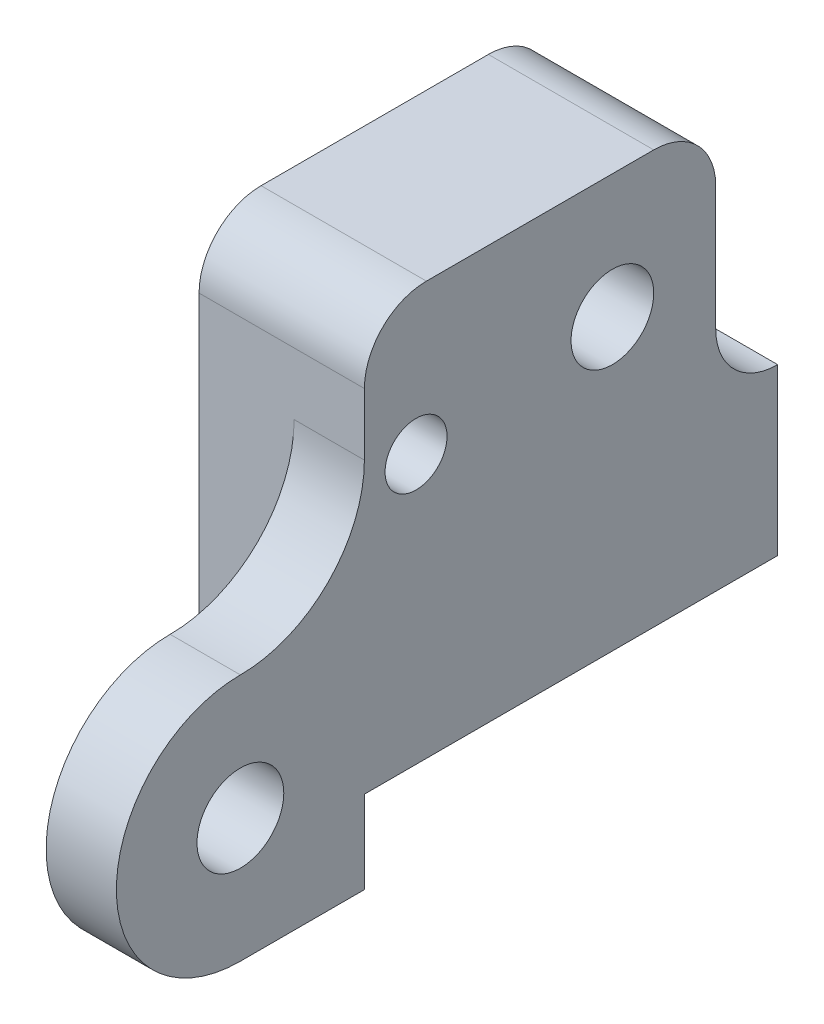
from build123d import *

# Parameters (mm, degrees)
SKETCH1_R                       = 1.5
SKETCH1_R_2                     = 2
BOSS_EXTRUDE1_DEPTH             = 8
FILLET1_R                       = 3
FILLET2_R                       = 6
TAP_DRILL_FOR_M5X0_8_TAP1_D     = 4.2
TAP_DRILL_FOR_M3X0_5_TAP1_D     = 2.5
TAP_DRILL_FOR_M3X0_5_TAP1_DEPTH = 6
TAP_DRILL_FOR_M3X0_5_TAP1_TIP   = 0.751075774
CUT_EXTRUDE1_REACH              = 38.277
SKETCH7_W                       = 4.6
SKETCH7_H                       = 12


with BuildPart() as part:
    # Sketch1 → Boss-Extrude1 (new body)
    with BuildSketch(Plane(origin=(0, 0, 0), x_dir=(0, 0, -1), z_dir=(1, 0, 0))):
        with BuildLine():
            Line((6, 0), (0, 0))
            ThreePointArc((0, 0), (-6, 6), (0, 12))
            Line((0, 12), (6, 12))
            Line((6, 12), (6, 24))
            Line((6, 24), (23, 24))
            Line((23, 24), (23, 12))
            Line((23, 12), (26, 12))
            Line((26, 12), (26, 4))
            Line((26, 4), (6, 4))
            Line((6, 4), (6, 0))
        make_face()
        with Locations((8.5, 17)):
            Circle(SKETCH1_R, mode=Mode.SUBTRACT)
        with Locations((18, 18)):
            Circle(SKETCH1_R_2, mode=Mode.SUBTRACT)
    extrude(amount=BOSS_EXTRUDE1_DEPTH)

    # Fillet1
    fillet1_edges = [part.edges().sort_by_distance(p)[0] for p in [
        (4, 12, -23),
        (4, 24, -6),
        (4, 24, -23),
    ]]
    fillet(fillet1_edges, radius=FILLET1_R - 0.0001)  # a hair under: the kernel refuses the full size

    # Fillet2
    fillet2_edges = [part.edges().sort_by_distance(p)[0] for p in [
        (4, 12, -6),
    ]]
    fillet(fillet2_edges, radius=FILLET2_R - 0.0001)  # a hair under: the kernel refuses the full size

    # Tap Drill for M5x0.8 Tap1 (through all)
    with Locations(Plane(origin=(8, 0, 0), x_dir=(0, 0, -1), z_dir=(1, 0, 0))):
        with Locations((0, 6)):
            Hole(TAP_DRILL_FOR_M5X0_8_TAP1_D / 2)

    # Tap Drill for M3x0.5 Tap1
    with Locations(Plane(origin=(0, 4, 0), x_dir=(-1, 0, 0), z_dir=(0, -1, 0))):
        with Locations((-4, 10), (-4, 22)):
            Hole(TAP_DRILL_FOR_M3X0_5_TAP1_D / 2, depth=TAP_DRILL_FOR_M3X0_5_TAP1_DEPTH)
            with Locations((0, 0, -(TAP_DRILL_FOR_M3X0_5_TAP1_DEPTH + TAP_DRILL_FOR_M3X0_5_TAP1_TIP / 2))):  # 118° drill point
                Cone(0, TAP_DRILL_FOR_M3X0_5_TAP1_D / 2, TAP_DRILL_FOR_M3X0_5_TAP1_TIP, mode=Mode.SUBTRACT)

    # Sketch7 → Cut-Extrude1 (cut, up to next)
    with BuildSketch(Plane.XZ, mode=Mode.PRIVATE) as cut_extrude1_sk1:
        with Locations((2.3, 0)):
            Rectangle(SKETCH7_W, SKETCH7_H)
    cut_extrude1_tool1 = extrude(cut_extrude1_sk1.sketch, amount=-CUT_EXTRUDE1_REACH, mode=Mode.PRIVATE) & part.part
    add(cut_extrude1_tool1.solids().sort_by_distance((2.3, 0, 0))[0], mode=Mode.SUBTRACT)


solid = part.part
